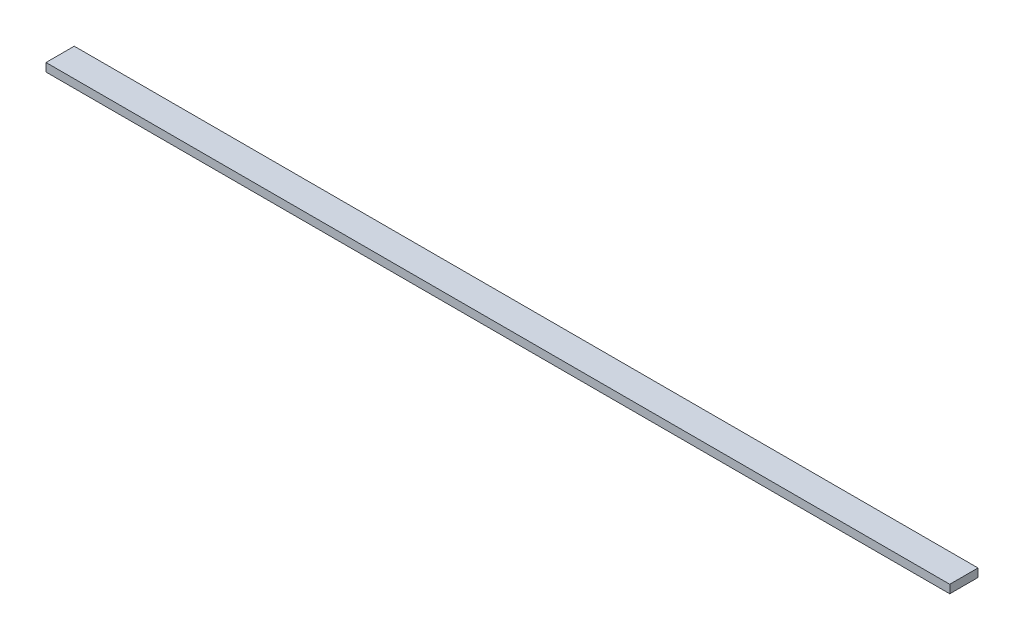
from build123d import *

# Parameters (mm, degrees)
SKETCH1_W           = 609.6
SKETCH1_H           = 19.05
BOSS_EXTRUDE1_DEPTH = 5.588


with BuildPart() as part:
    # Sketch1 → Boss-Extrude1 (new body)
    with BuildSketch(Plane(origin=(0, 0, 0), x_dir=(1, 0, 0), z_dir=(0, 1, 0))):
        Rectangle(SKETCH1_W, SKETCH1_H)
    extrude(amount=BOSS_EXTRUDE1_DEPTH)


solid = part.part
